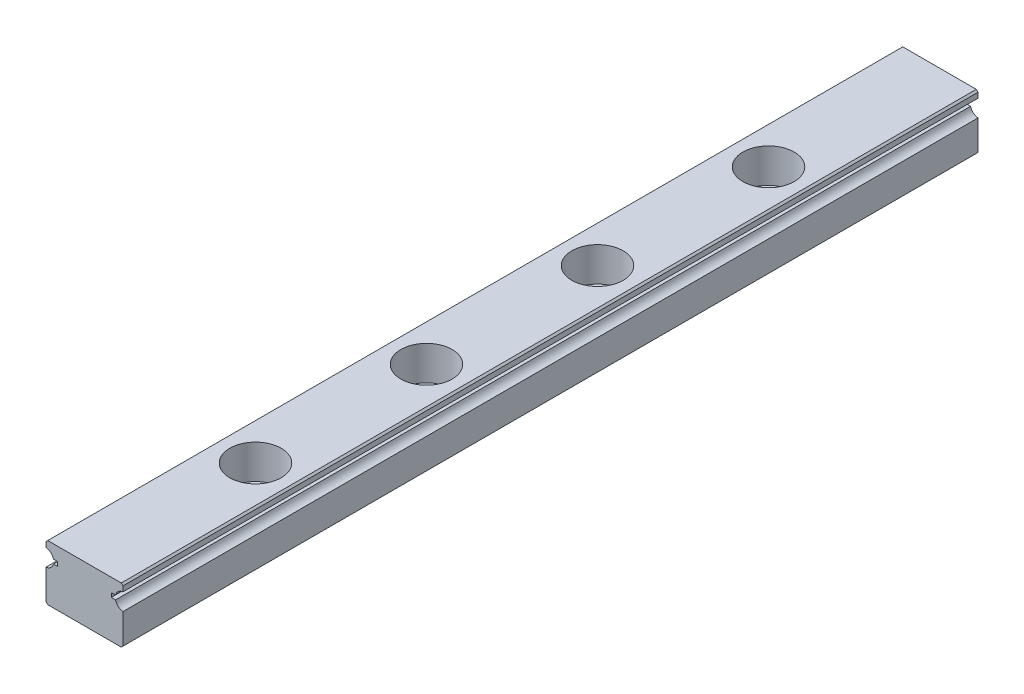
from build123d import *

# Parameters (mm, degrees)
EXTRUDE_RAIL_PROFILE_DEPTH     = 100
CBORE_FOR_M3_SHCS2_D           = 3.5
CBORE_FOR_M3_SHCS2_CBORE_D     = 6
CBORE_FOR_M3_SHCS2_CBORE_DEPTH = 4
FILL_START                     = -2.2
FILL_PATTERN_OUTLINE_R         = 3
FILL_PATTERN_DEPTH             = 4
FILL_START_2                   = -4.7
FILL_PATTERN_2_OUTLINE_R       = 1.75
FILL_PATTERN_2_DEPTH           = 2.5


# Read off the part's stored shape, not the designer's step: Fill Pattern
with BuildPart() as part:
    # Rail Profile Sketch → Extrude Rail Profile (new body)
    with BuildSketch(Plane.XY):
        with BuildLine():
            Line((-4.3, -4.7), (4.3, -4.7))
            Line((4.3, -4.7), (4.5, -4.5))
            Line((4.5, -4.5), (4.5, -0.994987437))
            ThreePointArc((4.5, -0.994987437), (3.948817336, -0.758921035), (3.631754163, -0.25))
            Line((3.631754163, -0.25), (3.131754163, -0.25))
            Line((3.131754163, -0.25), (3.131754163, 0.25))
            Line((3.131754163, 0.25), (3.631754163, 0.25))
            ThreePointArc((3.631754163, 0.25), (3.948817336, 0.758921035), (4.5, 0.994987437))
            Line((4.5, 0.994987437), (4.5, 1.6))
            Line((4.5, 1.6), (4.3, 1.8))
            Line((4.3, 1.8), (-4.3, 1.8))
            Line((-4.3, 1.8), (-4.5, 1.6))
            Line((-4.5, 1.6), (-4.5, 0.994987437))
            ThreePointArc((-4.5, 0.994987437), (-3.948817336, 0.758921035), (-3.631754163, 0.25))
            Line((-3.631754163, 0.25), (-3.131754163, 0.25))
            Line((-3.131754163, 0.25), (-3.131754163, -0.25))
            Line((-3.131754163, -0.25), (-3.631754163, -0.25))
            ThreePointArc((-3.631754163, -0.25), (-3.948817336, -0.758921035), (-4.5, -0.994987437))
            Line((-4.5, -0.994987437), (-4.5, -4.5))
            Line((-4.5, -4.5), (-4.3, -4.7))
        make_face()
    extrude(amount=EXTRUDE_RAIL_PROFILE_DEPTH)

    # CBORE for M3 SHCS2 (through all)
    with Locations(Plane(origin=(0, 1.8, 0), x_dir=(1, 0, 0), z_dir=(0, 1, 0))):
        with Locations((0, -40)):
            CounterBoreHole(CBORE_FOR_M3_SHCS2_D / 2, CBORE_FOR_M3_SHCS2_CBORE_D / 2, CBORE_FOR_M3_SHCS2_CBORE_DEPTH)

    # Fill Pattern outline → Fill Pattern (cut)
    with BuildSketch(Plane(origin=(0, 0, 0), x_dir=(1, 0, 0), z_dir=(0, 1, 0)).offset(FILL_START)):
        with Locations((0, -20)):
            Circle(FILL_PATTERN_OUTLINE_R)
        with Locations((0, -60)):
            Circle(FILL_PATTERN_OUTLINE_R)
        with Locations((0, -80)):
            Circle(FILL_PATTERN_OUTLINE_R)
    extrude(amount=FILL_PATTERN_DEPTH, mode=Mode.SUBTRACT)

    # Fill Pattern 2 outline → Fill Pattern 2 (cut)
    with BuildSketch(Plane(origin=(0, 0, 0), x_dir=(1, 0, 0), z_dir=(0, 1, 0)).offset(FILL_START_2)):
        with Locations((0, -20)):
            Circle(FILL_PATTERN_2_OUTLINE_R)
        with Locations((0, -60)):
            Circle(FILL_PATTERN_2_OUTLINE_R)
        with Locations((0, -80)):
            Circle(FILL_PATTERN_2_OUTLINE_R)
    extrude(amount=FILL_PATTERN_2_DEPTH, mode=Mode.SUBTRACT)


solid = part.part
